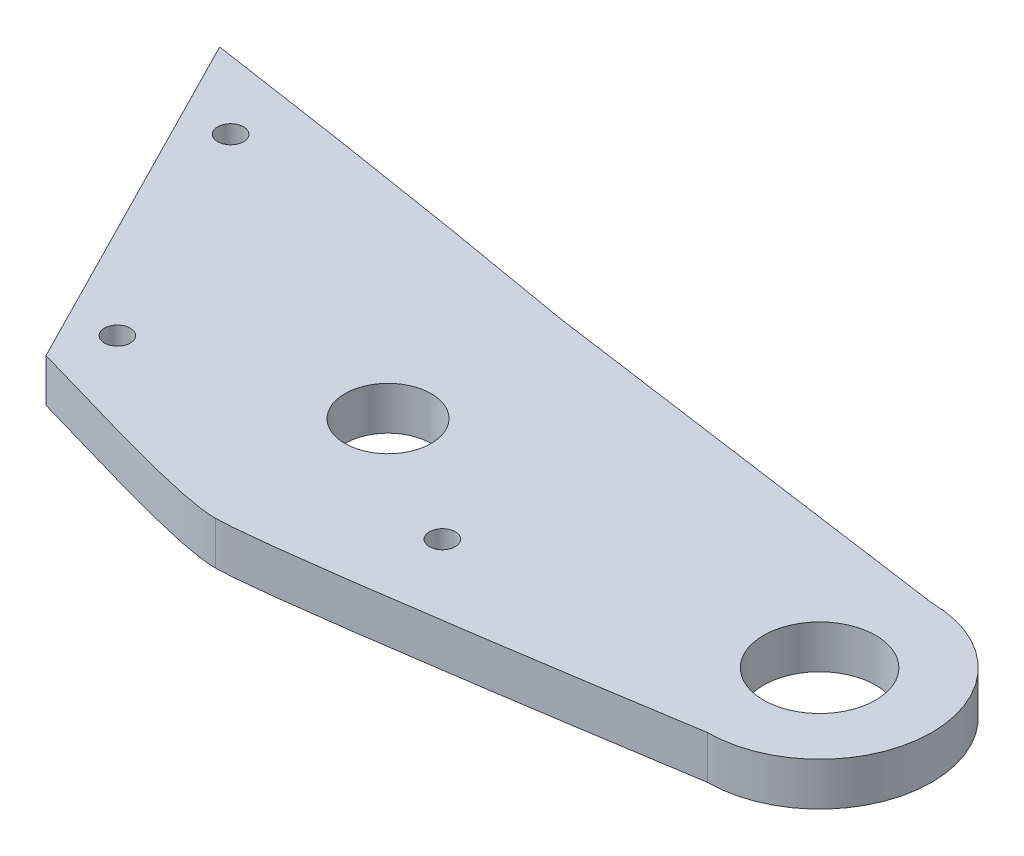
from build123d import *

# Parameters (mm, degrees)
BOSS_EXTRUDE1_DEPTH      = 20
BOSS_EXTRUDE1_DEPTH_BACK = 20
SKETCH1_R                = 5
SKETCH1_R_2              = 6.5
CUT_EXTRUDE4_DEPTH       = 35
SKETCH6_R                = 1.5
CUT_EXTRUDE5_DEPTH       = 10
CUT_EXTRUDE6_DEPTH       = 50


with BuildPart() as part:
    # Sketch1 → Boss-Extrude1 (new, two sides: drawn at the far end of the back side and taken through both)
    with BuildSketch(Plane(origin=(0, 0, 0), x_dir=(1, 0, 0), z_dir=(0, 1, 0)).offset(-BOSS_EXTRUDE1_DEPTH_BACK)):
        with BuildLine():
            ThreePointArc((-328.284271247, 28.284271247), (-328.284271247, -28.284271247), (-271.715728753, -28.284271247))
            add(Edge.make_bspline(
                [(-271.715728753, -28.284271247), (-189.219937614, 54.211519891), (-20, -20), (3.938998468, -20), (20.605665135, -17.666666667), (50, -13)],
                knots=[0, 0, 0, 0, 1, 1, 1.196949923, 1.196949923, 1.196949923, 1.196949923], degree=3))
            ThreePointArc((50, -13), (63, 0), (50, 13))
            add(Edge.make_bspline(
                [(50, 13), (0.03150303, 20), (0, 20)],
                knots=[0.330604416, 0.330604416, 0.330604416, 1.330604416, 1.330604416, 1.330604416], degree=2))
            add(Edge.make_bspline(
                [(0, 20), (-114.873131821, 40.378289836), (-300, 56.568542495), (-328.284271247, 28.284271247)],
                knots=[0.1900067, 0.1900067, 0.1900067, 0.1900067, 1.1900067, 1.1900067, 1.1900067, 1.1900067], degree=3))
        make_face()
        Circle(SKETCH1_R, mode=Mode.SUBTRACT)
        with Locations((50, 0)):
            Circle(SKETCH1_R_2, mode=Mode.SUBTRACT)
    extrude(amount=BOSS_EXTRUDE1_DEPTH + BOSS_EXTRUDE1_DEPTH_BACK)

    # Sketch5 → Cut-Extrude4 (cut)
    with BuildSketch(Plane(origin=(0, 20, 0), x_dir=(1, 0, 0), z_dir=(0, 1, 0))):
        Polygon((-47.037049996, 27.527548523), (92.120786702, 16.164640032), (85.724700256, -16.918764701), (-17.262768022, -30.907770073), align=None)
    extrude(amount=-CUT_EXTRUDE4_DEPTH, mode=Mode.SUBTRACT)

    # Sketch6 → Cut-Extrude5 (cut)
    with BuildSketch(Plane(origin=(0, -20, 0), x_dir=(-1, 0, 0), z_dir=(0, -1, 0))):
        with Locations((24.005160607, -7.356928903)):
            Circle(SKETCH6_R)
        with Locations((-15.251108102, -8.960330165)):
            Circle(SKETCH6_R)
        with Locations((37.643080162, 19.408995291)):
            Circle(SKETCH6_R)
    extrude(amount=-CUT_EXTRUDE5_DEPTH, mode=Mode.SUBTRACT)

    # Sketch7 → Cut-Extrude6 (cut)
    with BuildSketch(Plane(origin=(0, 20, 0), x_dir=(1, 0, 0), z_dir=(0, 1, 0))):
        Polygon((-47.037049996, 27.527548523), (-26.137658318, -13.489817144), (-379.595719096, -92.580220424), (-321.505561991, 137.254748988), align=None)
    extrude(amount=-CUT_EXTRUDE6_DEPTH, mode=Mode.SUBTRACT)


solid = part.part
